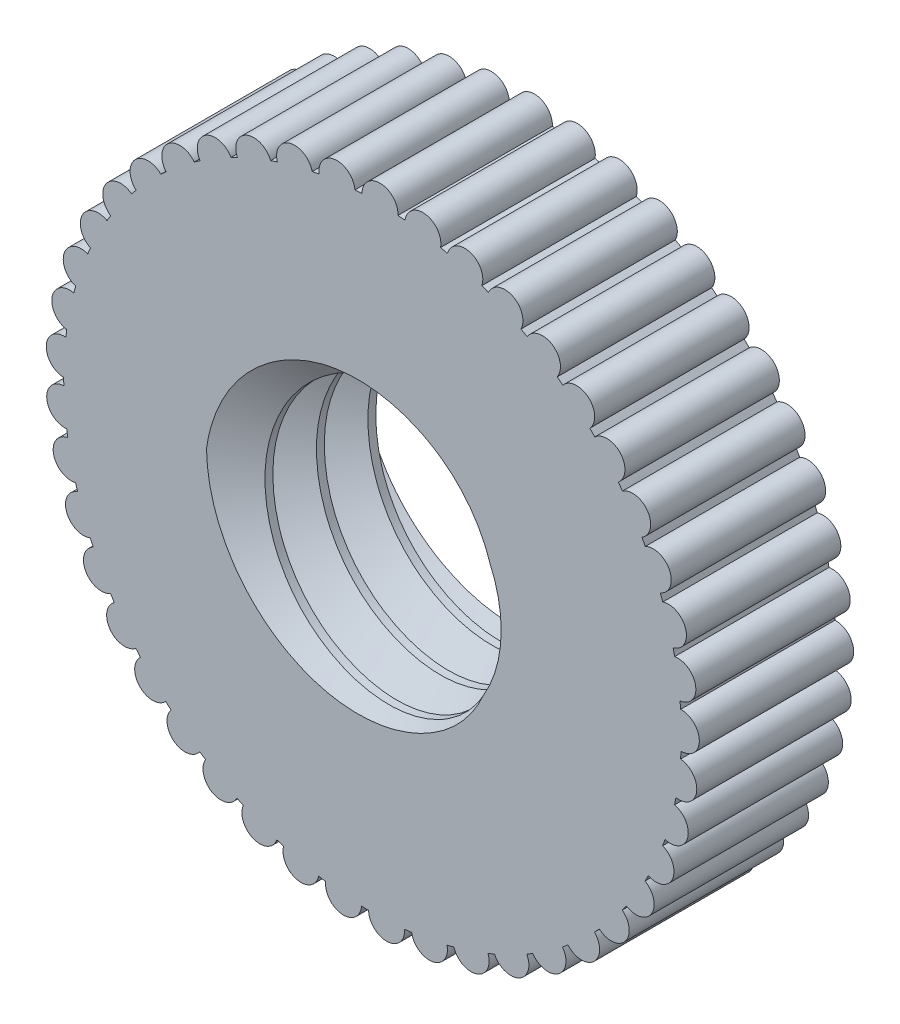
from build123d import *

# Parameters (mm, degrees)
SKETCH1_R           = 3
SKETCH1_R_2         = 1.25
BOSS_EXTRUDE1_DEPTH = 1.5
CUT_SWEEP1_PITCH    = 0.5
SKETCH4_R           = 0.175
BOSS_EXTRUDE2_DEPTH = 1.5


with BuildPart() as part:
    # Sketch1 → Boss-Extrude1 (new body)
    with BuildSketch(Plane.XY):
        Circle(SKETCH1_R)
        Circle(SKETCH1_R_2, mode=Mode.SUBTRACT)
    extrude(amount=BOSS_EXTRUDE1_DEPTH)

    # Cut-Sweep1: arcs per turn and ends read off the stored shape
    # Cut-Sweep1: the profile of Sketch3 screwed along a right-hand helix through 5 turns, 6 arcs to a turn; built about Z, then put on its axis
    cut_sweep1_z = Axis((0, 0, 0), (0, 0, 1))
    cut_sweep1_corners = [(1.616051444, 0.000284131, -0.504463126), (1.20035925, 0.015532138, -0.743978258), (1.20035925, -0.014963875, -0.264947995)]
    with BuildLine(mode=Mode.PRIVATE) as cut_sweep1_profile:
        Line(cut_sweep1_corners[0], cut_sweep1_corners[1])
        Line(cut_sweep1_corners[1], cut_sweep1_corners[2])
        Line(cut_sweep1_corners[2], cut_sweep1_corners[0])
    cut_sweep1_cap = Face(cut_sweep1_profile.wire())
    cut_sweep1_turn_angles = [0, 30, 60, 90, 120, 150, 180, 210, 240, 270, 300, 330, 360]
    cut_sweep1_turn_weights = [1, 0.8660254037844387, 1, 0.8660254037844387, 1, 0.8660254037844387, 1, 0.8660254037844387, 1, 0.8660254037844387, 1, 0.8660254037844387, 1]
    cut_sweep1_turn_rails = [Edge.make_bspline([Vector(p[0], p[1], 0).rotate(cut_sweep1_z, cut_sweep1_turn_angles[k]) / cut_sweep1_turn_weights[k] + Vector(0, 0, p[2] + CUT_SWEEP1_PITCH * cut_sweep1_turn_angles[k] / 360) for k in range(13)], [0, 0, 0, 1, 1, 2, 2, 3, 3, 4, 4, 5, 5, 6, 6, 6], 2, cut_sweep1_turn_weights) for p in cut_sweep1_corners]
    cut_sweep1_turn_sides = [Face.make_surface_from_curves(cut_sweep1_turn_rails[p[0]], cut_sweep1_turn_rails[p[1]]) for p in [(0, 1), (1, 2), (2, 0)]]
    cut_sweep1 = Plane(origin=(0, 0, 1.5), x_dir=(-1, 0, 0), z_dir=(0, 0, -1)) * Solid(Shell([*[p.moved(Location((0, 0, CUT_SWEEP1_PITCH * i))) for i in range(5) for p in cut_sweep1_turn_sides], cut_sweep1_cap, cut_sweep1_cap.rotate(cut_sweep1_z, 1800).moved(Location((0, 0, CUT_SWEEP1_PITCH * 1800 / 360)))]))
    add(cut_sweep1, mode=Mode.SUBTRACT)

    # Sketch4 → Boss-Extrude2 (add)
    with BuildSketch(Plane.XY.offset(1.5)):
        with Locations((-2.990275103, -0.241360326)):
            Circle(SKETCH4_R)
        with Locations((-2.994764816, 0.177154435)):
            Circle(SKETCH4_R)
        with Locations((-2.940964839, 0.592221086)):
            Circle(SKETCH4_R)
        with Locations((-2.829922326, 0.995760828)):
            Circle(SKETCH4_R)
        with Locations((-2.663798595, 1.379919218)):
            Circle(SKETCH4_R)
        with Locations((-2.445827053, 1.737219049)):
            Circle(SKETCH4_R)
        with Locations((-2.18025027, 2.060705889)):
            Circle(SKETCH4_R)
        with Locations((-1.872237396, 2.344083431)):
            Circle(SKETCH4_R)
        with Locations((-1.52778355, 2.581836057)):
            Circle(SKETCH4_R)
        with Locations((-1.153593135, 2.76933618)):
            Circle(SKETCH4_R)
        with Locations((-0.756949343, 2.902934325)):
            Circle(SKETCH4_R)
        with Locations((-0.345572392, 2.980030155)):
            Circle(SKETCH4_R)
        with Locations((0.072530733, 2.999123087)):
            Circle(SKETCH4_R)
        with Locations((0.489222129, 2.959841501)):
            Circle(SKETCH4_R)
        with Locations((0.896391373, 2.862949966)):
            Circle(SKETCH4_R)
        with Locations((1.286113378, 2.710334367)):
            Circle(SKETCH4_R)
        with Locations((1.650802649, 2.504965192)):
            Circle(SKETCH4_R)
        with Locations((1.983360925, 2.250839719)):
            Circle(SKETCH4_R)
        with Locations((2.277315336, 1.952904211)):
            Circle(SKETCH4_R)
        with Locations((2.526944395, 1.616957645)):
            Circle(SKETCH4_R)
        with Locations((2.727389355, 1.249538837)):
            Circle(SKETCH4_R)
        with Locations((2.874748784, 0.857799176)):
            Circle(SKETCH4_R)
        with Locations((2.966154498, 0.449363431)):
            Circle(SKETCH4_R)
        with Locations((2.999827389, 0.032181338)):
            Circle(SKETCH4_R)
        with Locations((2.975112051, -0.385627129)):
            Circle(SKETCH4_R)
        with Locations((2.892489542, -0.795929802)):
            Circle(SKETCH4_R)
        with Locations((2.753568014, -1.190740607)):
            Circle(SKETCH4_R)
        with Locations((2.561051416, -1.562375001)):
            Circle(SKETCH4_R)
        with Locations((2.318686866, -1.903599542)):
            Circle(SKETCH4_R)
        with Locations((2.031191714, -2.207772683)):
            Circle(SKETCH4_R)
        with Locations((1.704161725, -2.468974041)):
            Circle(SKETCH4_R)
        with Locations((1.343962167, -2.682119627)):
            Circle(SKETCH4_R)
        with Locations((0.957603914, -2.843060806)):
            Circle(SKETCH4_R)
        with Locations((0.55260699, -2.948665039)):
            Circle(SKETCH4_R)
        with Locations((0.1368542, -2.996876862)):
            Circle(SKETCH4_R)
        with Locations((-0.281562302, -2.986757886)):
            Circle(SKETCH4_R)
        with Locations((-0.694498514, -2.918505065)):
            Circle(SKETCH4_R)
        with Locations((-1.093917102, -2.793446862)):
            Circle(SKETCH4_R)
        with Locations((-1.472043838, -2.614017394)):
            Circle(SKETCH4_R)
        with Locations((-1.821518916, -2.383709051)):
            Circle(SKETCH4_R)
        with Locations((-2.135540199, -2.107004522)):
            Circle(SKETCH4_R)
        with Locations((-2.407995622, -1.789289547)):
            Circle(SKETCH4_R)
        with Locations((-2.633582149, -1.436748087)):
            Circle(SKETCH4_R)
        with Locations((-2.807908995, -1.056241959)):
            Circle(SKETCH4_R)
        with Locations((-2.927583086, -0.655177283)):
            Circle(SKETCH4_R)
    extrude(amount=-BOSS_EXTRUDE2_DEPTH)


solid = part.part
